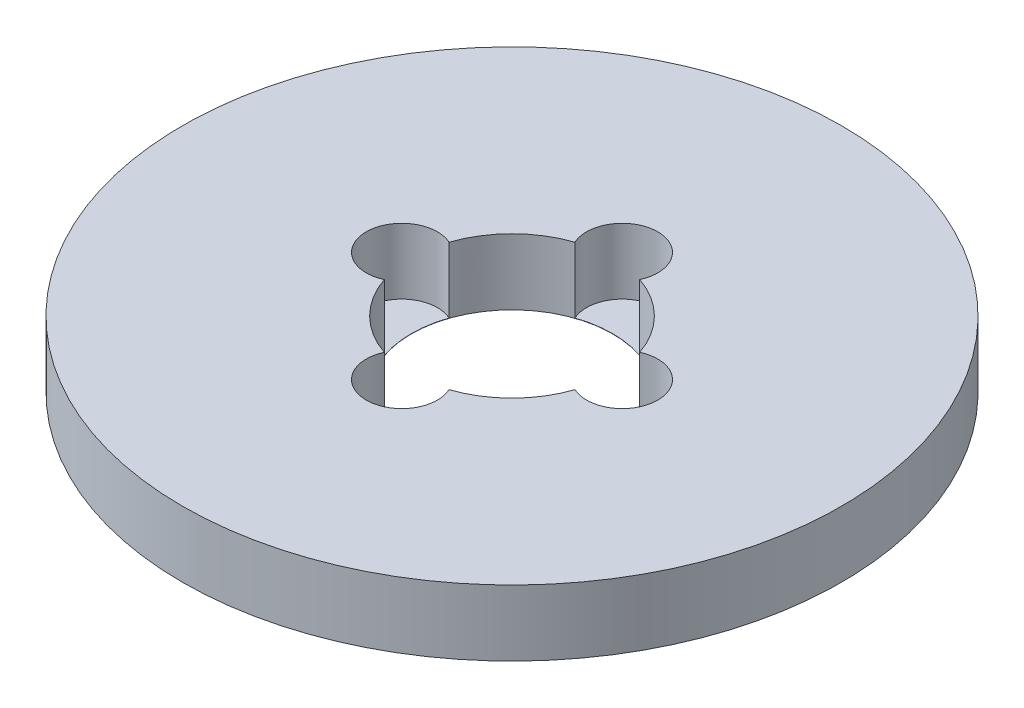
from build123d import *

# Parameters (mm, degrees)
SKETCH1_R           = 90
BOSS_EXTRUDE1_DEPTH = 18
SKETCH2_R           = 27.5
CUT_EXTRUDE1_DEPTH  = 129.545711714
SKETCH3_R           = 9.726048631
CUT_EXTRUDE2_DEPTH  = 17.93395561
CIRPATTERN1_COUNT   = 4


with BuildPart() as part:
    # Sketch1 → Boss-Extrude1 (new body)
    with BuildSketch(Plane(origin=(0, 0, 0), x_dir=(1, 0, 0), z_dir=(0, 1, 0))):
        Circle(SKETCH1_R)
    extrude(amount=BOSS_EXTRUDE1_DEPTH)

    # Sketch2 → Cut-Extrude1 (cut, through all)
    with BuildSketch(Plane(origin=(0, 0, 0), x_dir=(1, 0, 0), z_dir=(0, 1, 0))):
        Circle(SKETCH2_R)
    extrude(amount=CUT_EXTRUDE1_DEPTH, mode=Mode.SUBTRACT)

    # Sketch3 → Cut-Extrude2 (cut)
    with BuildSketch(Plane(origin=(0, 18, 0), x_dir=(1, 0, 0), z_dir=(0, 1, 0))):
        with Locations((-30.089367893, 0)):
            Circle(SKETCH3_R)
    cut_extrude2 = extrude(amount=-CUT_EXTRUDE2_DEPTH, mode=Mode.SUBTRACT)

    # CirPattern1: Cut-Extrude2 ×4 about axis
    cirpattern1_axis = Axis((0, 0, 0), (0, 1, 0))
    for i in range(1, CIRPATTERN1_COUNT):
        add(cut_extrude2.rotate(cirpattern1_axis, i * 360 / CIRPATTERN1_COUNT), mode=Mode.SUBTRACT)


solid = part.part
